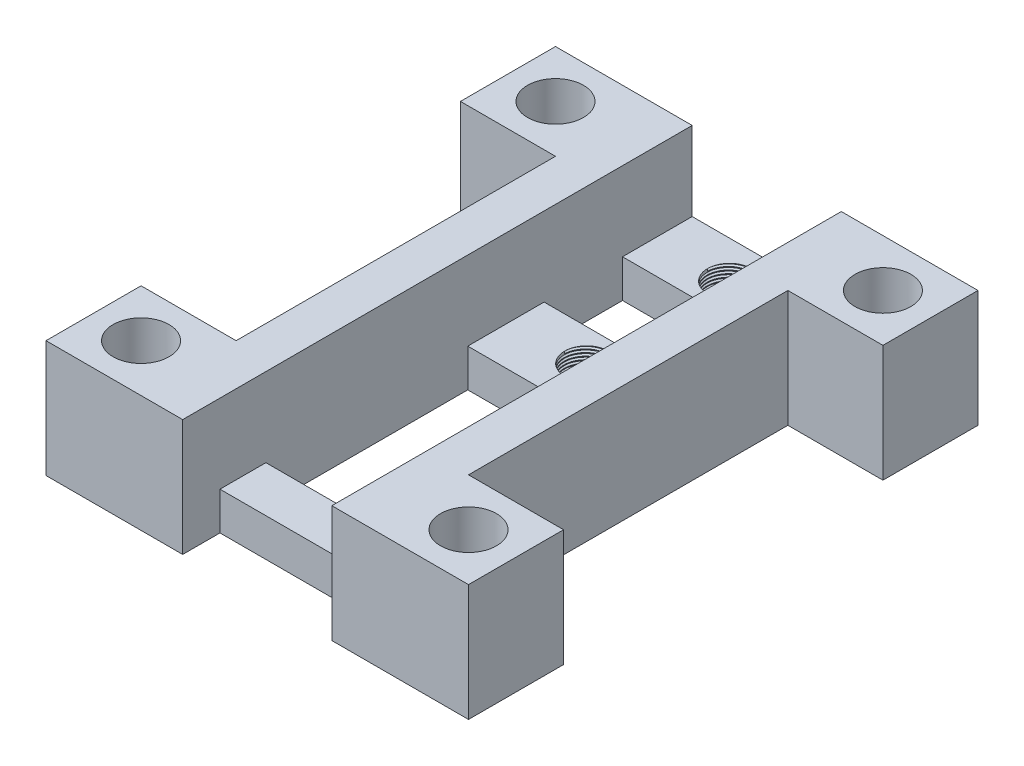
from build123d import *

# Parameters (mm, degrees)
SKETCH1_W           = 34
SKETCH1_H           = 41
BOSS_EXTRUDE1_DEPTH = 14.4
SKETCH2_R           = 2.25
SKETCH2_W           = 7.65
SKETCH2_H           = 25.7
CUT_EXTRUDE1_DEPTH  = 56.175719298
SKETCH3_W           = 12
SKETCH3_H           = 41
CUT_EXTRUDE2_DEPTH  = 6.35
SKETCH8_W           = 12
SKETCH8_H           = 5.5
CUT_EXTRUDE5_DEPTH  = 54.868381264
CUT_EXTRUDE6_DEPTH  = 54.868381264
SKETCH11_W          = 34
SKETCH11_H          = 5
CUT_EXTRUDE7_DEPTH  = 56.175719298
SKETCH12_R          = 1.757066294
CUT_EXTRUDE8_DEPTH  = 54.640679526
THREAD1_PITCH       = 0.25
THREAD2_PITCH       = 0.25
SKETCH17_W          = 5.4
SKETCH17_H          = 6
SKETCH17_W_2        = 12
SKETCH17_H_2        = 3
CUT_EXTRUDE9_DEPTH  = 54.640679526
SKETCH18_W          = 12
SKETCH18_H          = 16.243609815
CUT_EXTRUDE10_DEPTH = 10
SKETCH19_W          = 12
SKETCH19_H          = 6.3137706
CUT_EXTRUDE11_DEPTH = 10


with BuildPart() as part:
    # Sketch1 → Boss-Extrude1 (new body)
    with BuildSketch(Plane(origin=(0, 0, 0), x_dir=(1, 0, 0), z_dir=(0, 1, 0))):
        with Locations((17, -20.5)):
            Rectangle(SKETCH1_W, SKETCH1_H)
    extrude(amount=BOSS_EXTRUDE1_DEPTH)

    # Sketch2 → Cut-Extrude1 (cut, through all)
    with BuildSketch(Plane(origin=(0, 14.4, 0), x_dir=(1, 0, 0), z_dir=(0, 1, 0))):
        with Locations(Location((3.825, -3.825, 0), (0, 0, 270))):
            Circle(SKETCH2_R)
        with Locations(Location((30.175, -3.825, 0), (0, 0, 90))):
            Circle(SKETCH2_R)
        with Locations(Location((30.175, -37.175, 0), (0, 0, 270))):
            Circle(SKETCH2_R)
        with Locations(Location((3.825, -37.175, 0), (0, 0, 90))):
            Circle(SKETCH2_R)
        with Locations((3.825, -20.5)):
            Rectangle(SKETCH2_W, SKETCH2_H)
        with Locations((30.175, -20.5)):
            Rectangle(SKETCH2_W, SKETCH2_H)
    extrude(amount=-CUT_EXTRUDE1_DEPTH, mode=Mode.SUBTRACT)

    # Sketch3 → Cut-Extrude2 (cut)
    with BuildSketch(Plane(origin=(0, 14.4, 0), x_dir=(1, 0, 0), z_dir=(0, 1, 0))):
        with Locations((17, -20.5)):
            Rectangle(SKETCH3_W, SKETCH3_H)
    extrude(amount=-CUT_EXTRUDE2_DEPTH, mode=Mode.SUBTRACT)

    # Sketch8 → Cut-Extrude5 (cut, through all)
    with BuildSketch(Plane(origin=(0, 8.05, 0), x_dir=(1, 0, 0), z_dir=(0, 1, 0))):
        with Locations((17, -8.75)):
            Rectangle(SKETCH8_W, SKETCH8_H)
    extrude(amount=-CUT_EXTRUDE5_DEPTH, mode=Mode.SUBTRACT)

    # Sketch4 → Cut-Extrude6 (cut, through all)
    with BuildSketch(Plane(origin=(0, 8.05, 0), x_dir=(1, 0, 0), z_dir=(0, 1, 0))):
        with BuildLine():
            Line((13.25, -23), (13.25, -26.75))
            Line((13.25, -26.75), (20.5, -26.75))
            Line((20.5, -26.75), (20.75, -26.75))
            Line((20.75, -26.75), (20.75, -23))
            ThreePointArc((20.75, -23), (17, -19.25), (13.25, -23))
        make_face()
    extrude(amount=-CUT_EXTRUDE6_DEPTH, mode=Mode.SUBTRACT)

    # Sketch11 → Cut-Extrude7 (cut, through all)
    with BuildSketch(Plane(origin=(0, 0, 0), x_dir=(-1, 0, 0), z_dir=(0, 0, -1))):
        with Locations((-17, 2.5)):
            Rectangle(SKETCH11_W, SKETCH11_H)
    extrude(amount=-CUT_EXTRUDE7_DEPTH, mode=Mode.SUBTRACT)

    # Sketch12 → Cut-Extrude8 (cut, through all)
    with BuildSketch(Plane(origin=(0, 8.05, 0), x_dir=(1, 0, 0), z_dir=(0, 1, 0))):
        with Locations(Location((17, -14.5, 0), (0, 0, 270))):
            Circle(SKETCH12_R)
        with Locations(Location((17, -3, 0), (0, 0, 90))):
            Circle(SKETCH12_R)
    extrude(amount=-CUT_EXTRUDE8_DEPTH, mode=Mode.SUBTRACT)

    # Thread1: the profile of Thread Profile1 profile screwed along a right-hand helix of 8 turns, 6 arcs to a turn; built about Z, then put on its axis
    thread1_z = Axis((0, 0, 0), (0, 0, 1))
    thread1_corners = [(1.756766294, 0, -0.000173205), (1.892382763, 0, 0.078125), (1.892382763, 0, 0.109375), (1.756766294, 0, 0.187673204)]
    with BuildLine(mode=Mode.PRIVATE) as thread1_profile:
        Line(thread1_corners[0], thread1_corners[1])
        Line(thread1_corners[1], thread1_corners[2])
        Line(thread1_corners[2], thread1_corners[3])
        Line(thread1_corners[3], thread1_corners[0])
    thread1_cap = Face(thread1_profile.wire())
    thread1_turn_angles = [0, 30, 60, 90, 120, 150, 180, 210, 240, 270, 300, 330, 360]
    thread1_turn_weights = [1, 0.8660254037844387, 1, 0.8660254037844387, 1, 0.8660254037844387, 1, 0.8660254037844387, 1, 0.8660254037844387, 1, 0.8660254037844387, 1]
    thread1_turn_rails = [Edge.make_bspline([Vector(p[0], p[1], 0).rotate(thread1_z, thread1_turn_angles[k]) / thread1_turn_weights[k] + Vector(0, 0, p[2] + THREAD1_PITCH * thread1_turn_angles[k] / 360) for k in range(13)], [0, 0, 0, 1, 1, 2, 2, 3, 3, 4, 4, 5, 5, 6, 6, 6], 2, thread1_turn_weights) for p in thread1_corners]
    thread1_turn_sides = [Face.make_surface_from_curves(thread1_turn_rails[p[0]], thread1_turn_rails[p[1]]) for p in [(0, 1), (1, 2), (2, 3), (3, 0)]]
    thread1 = Plane(origin=(17, 8.05, 3), x_dir=(-1, 0, 0), z_dir=(0, -1, 0)) * Solid(Shell([*[p.moved(Location((0, 0, THREAD1_PITCH * i))) for i in range(8) for p in thread1_turn_sides], thread1_cap, thread1_cap.rotate(thread1_z, 2880).moved(Location((0, 0, THREAD1_PITCH * 2880 / 360)))]))
    add(thread1, mode=Mode.SUBTRACT)

    # Thread2: the profile of Thread Profile2 profile screwed along a right-hand helix of 8 turns, 6 arcs to a turn; built about Z, then put on its axis
    thread2_z = Axis((0, 0, 0), (0, 0, 1))
    thread2_corners = [(1.756766294, 0, -0.000173205), (1.892382763, 0, 0.078125), (1.892382763, 0, 0.109375), (1.756766294, 0, 0.187673204)]
    with BuildLine(mode=Mode.PRIVATE) as thread2_profile:
        Line(thread2_corners[0], thread2_corners[1])
        Line(thread2_corners[1], thread2_corners[2])
        Line(thread2_corners[2], thread2_corners[3])
        Line(thread2_corners[3], thread2_corners[0])
    thread2_cap = Face(thread2_profile.wire())
    thread2_turn_angles = [0, 30, 60, 90, 120, 150, 180, 210, 240, 270, 300, 330, 360]
    thread2_turn_weights = [1, 0.8660254037844387, 1, 0.8660254037844387, 1, 0.8660254037844387, 1, 0.8660254037844387, 1, 0.8660254037844387, 1, 0.8660254037844387, 1]
    thread2_turn_rails = [Edge.make_bspline([Vector(p[0], p[1], 0).rotate(thread2_z, thread2_turn_angles[k]) / thread2_turn_weights[k] + Vector(0, 0, p[2] + THREAD2_PITCH * thread2_turn_angles[k] / 360) for k in range(13)], [0, 0, 0, 1, 1, 2, 2, 3, 3, 4, 4, 5, 5, 6, 6, 6], 2, thread2_turn_weights) for p in thread2_corners]
    thread2_turn_sides = [Face.make_surface_from_curves(thread2_turn_rails[p[0]], thread2_turn_rails[p[1]]) for p in [(0, 1), (1, 2), (2, 3), (3, 0)]]
    thread2 = Plane(origin=(17, 8.05, 14.5), x_dir=(-1, 0, 0), z_dir=(0, -1, 0)) * Solid(Shell([*[p.moved(Location((0, 0, THREAD2_PITCH * i))) for i in range(8) for p in thread2_turn_sides], thread2_cap, thread2_cap.rotate(thread2_z, 2880).moved(Location((0, 0, THREAD2_PITCH * 2880 / 360)))]))
    add(thread2, mode=Mode.SUBTRACT)

    # Sketch17 → Cut-Extrude9 (cut, through all)
    with BuildSketch(Plane(origin=(0, 8.05, 0), x_dir=(1, 0, 0), z_dir=(0, 1, 0))):
        with Locations((13.7, -30.95)):
            Rectangle(SKETCH17_W, SKETCH17_H)
        with Locations((17, -39.5)):
            Rectangle(SKETCH17_W_2, SKETCH17_H_2)
    extrude(amount=-CUT_EXTRUDE9_DEPTH, mode=Mode.SUBTRACT)

    # Sketch18 → Cut-Extrude10 (cut)
    with BuildSketch(Plane(origin=(0, 8.05, 0), x_dir=(1, 0, 0), z_dir=(0, 1, 0))):
        with Locations((17, -26.18239354)):
            Rectangle(SKETCH18_W, SKETCH18_H)
    extrude(amount=-CUT_EXTRUDE10_DEPTH, mode=Mode.SUBTRACT)

    # Sketch19 → Cut-Extrude11 (cut)
    with BuildSketch(Plane(origin=(0, 8.05, 0), x_dir=(1, 0, 0), z_dir=(0, 1, 0))):
        with Locations((17, -8.762126476)):
            Rectangle(SKETCH19_W, SKETCH19_H)
    extrude(amount=-CUT_EXTRUDE11_DEPTH, mode=Mode.SUBTRACT)


solid = part.part
